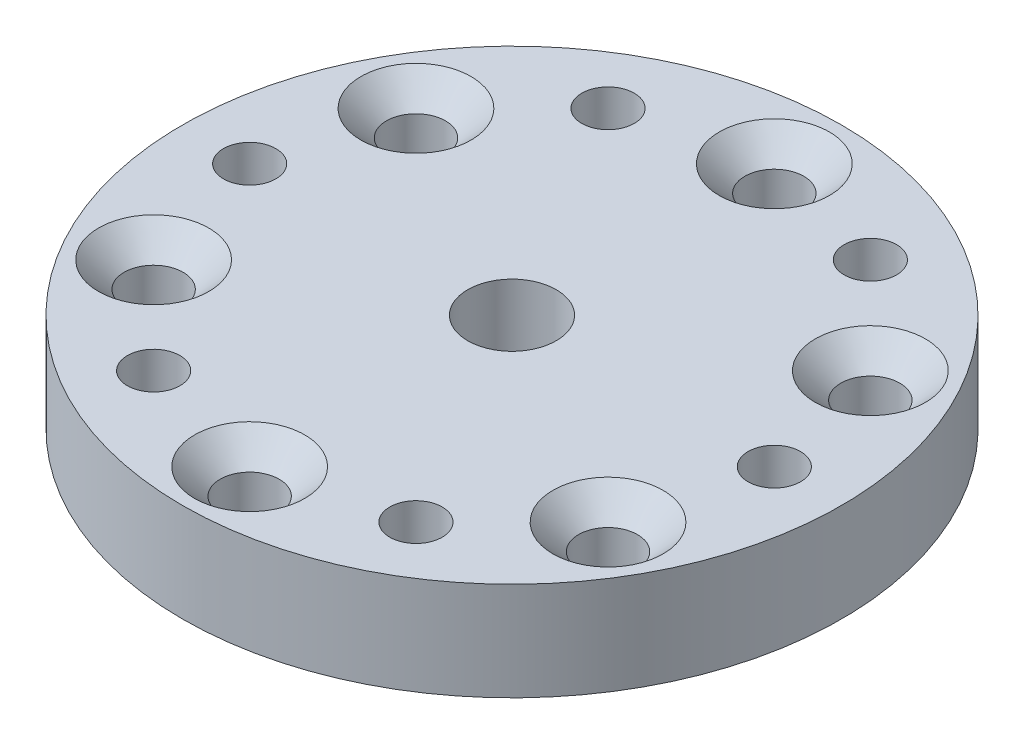
from build123d import *

# Parameters (mm, degrees)
SKETCH1_W            = 20.1
SKETCH1_H            = 6
SKETCH6_R            = 2.7
CUT_EXTRUDE2_DEPTH   = 30.052022305
CUT_EXTRUDE3_DEPTH   = 2.6
M3_CLEARANCE_HOLE2_D = 3.2
CIRPATTERN1_COUNT    = 6


# Read off the part's stored shape, not the designer's step: CSK for M3 Hex Socket Countersunk Cap Screw1
with BuildPart() as part:
    # Sketch1 → Revolve1 (revolve)
    with BuildSketch(Plane.XY, mode=Mode.PRIVATE) as revolve1_sk:
        with Locations((10.05, 3)):
            Rectangle(SKETCH1_W, SKETCH1_H)
    revolve(revolve1_sk.sketch.rotate(Axis((0, 0, 0), (0, 1, 0)), 90), axis=Axis((0, 0, 0), (0, 1, 0)))

    # Sketch6 → Cut-Extrude2 (cut, through all)
    with BuildSketch(Plane(origin=(0, 6, 0), x_dir=(1, 0, 0), z_dir=(0, 1, 0))):
        with Locations(Location((0, 0, 0), (0, 0, 270))):
            Circle(SKETCH6_R)
    extrude(amount=-CUT_EXTRUDE2_DEPTH, mode=Mode.SUBTRACT)

    # Sketch9 → Cut-Extrude3 (cut)
    with BuildSketch(Plane.XZ):
        Polygon((16, 3.233161507), (13.2, 1.616580754), (13.2, -1.616580754), (16, -3.233161507), (18.8, -1.616580754), (18.8, 1.616580754), align=None)
    cut_extrude3 = extrude(amount=-CUT_EXTRUDE3_DEPTH, mode=Mode.SUBTRACT)

    # M3 Clearance Hole2 (through all)
    with Locations(Plane(origin=(0, 2.6, 0), x_dir=(-1, 0, 0), z_dir=(0, -1, 0))):
        with Locations((-16, 0)):
            m3_clearance_hole2 = Hole(M3_CLEARANCE_HOLE2_D / 2)

    # CirPattern1: Cut-Extrude3, M3 Clearance Hole2 ×6 about axis
    cirpattern1_axis = Axis((0, 0, 0), (0, 1, 0))
    add([cut_extrude3.rotate(cirpattern1_axis, i * 360 / CIRPATTERN1_COUNT) for i in range(1, CIRPATTERN1_COUNT)], mode=Mode.SUBTRACT)
    add([m3_clearance_hole2.rotate(cirpattern1_axis, i * 360 / CIRPATTERN1_COUNT) for i in range(1, CIRPATTERN1_COUNT)], mode=Mode.SUBTRACT)

    # CSK for M3 Hex Socket Countersunk Ca 2 → CSK for M3 Hex Socket Countersunk Cap Screw1 (revolve, cut)
    with BuildSketch(Plane(origin=(-13.856406461, 0, 8), x_dir=(1, 0, 0), z_dir=(0, 0, 1))):
        Polygon((0, 0), (1.8, 0), (1.8, 4.44), (3.36, 6), (0, 6), align=None)
    revolve(axis=Axis((-13.856406461, 0, 8), (0, 1, 0)), mode=Mode.SUBTRACT)

    # CSK for M3 Hex Socket Countersunk Ca 3 o → CSK for M3 Hex Socket Countersunk Ca 3 (revolve, cut)
    with BuildSketch(Plane(origin=(-13.856406461, 0, -8), x_dir=(1, 0, 0), z_dir=(0, 0, 1))):
        Polygon((0, 0), (1.8, 0), (1.8, 4.44), (3.36, 6), (0, 6), align=None)
    revolve(axis=Axis((-13.856406461, 0, -8), (0, 1, 0)), mode=Mode.SUBTRACT)

    # CSK for M3 Hex Socket Countersunk Ca 4 o → CSK for M3 Hex Socket Countersunk Ca 4 (revolve, cut)
    with BuildSketch(Plane.XY.offset(-16)):
        Polygon((0, 0), (1.8, 0), (1.8, 4.44), (3.36, 6), (0, 6), align=None)
    revolve(axis=Axis((0, 0, -16), (0, 1, 0)), mode=Mode.SUBTRACT)

    # CSK for M3 Hex Socket Countersunk Ca 5 o → CSK for M3 Hex Socket Countersunk Ca 5 (revolve, cut)
    with BuildSketch(Plane(origin=(13.856406461, 0, -8), x_dir=(1, 0, 0), z_dir=(0, 0, 1))):
        Polygon((0, 0), (1.8, 0), (1.8, 4.44), (3.36, 6), (0, 6), align=None)
    revolve(axis=Axis((13.856406461, 0, -8), (0, 1, 0)), mode=Mode.SUBTRACT)

    # CSK for M3 Hex Socket Countersunk Ca 6 o → CSK for M3 Hex Socket Countersunk Ca 6 (revolve, cut)
    with BuildSketch(Plane(origin=(13.856406461, 0, 8), x_dir=(1, 0, 0), z_dir=(0, 0, 1))):
        Polygon((0, 0), (1.8, 0), (1.8, 4.44), (3.36, 6), (0, 6), align=None)
    revolve(axis=Axis((13.856406461, 0, 8), (0, 1, 0)), mode=Mode.SUBTRACT)

    # CSK for M3 Hex Socket Countersunk Ca 7 o → CSK for M3 Hex Socket Countersunk Ca 7 (revolve, cut)
    with BuildSketch(Plane.XY.offset(16)):
        Polygon((0, 0), (1.8, 0), (1.8, 4.44), (3.36, 6), (0, 6), align=None)
    revolve(axis=Axis((0, 0, 16), (0, 1, 0)), mode=Mode.SUBTRACT)


solid = part.part
